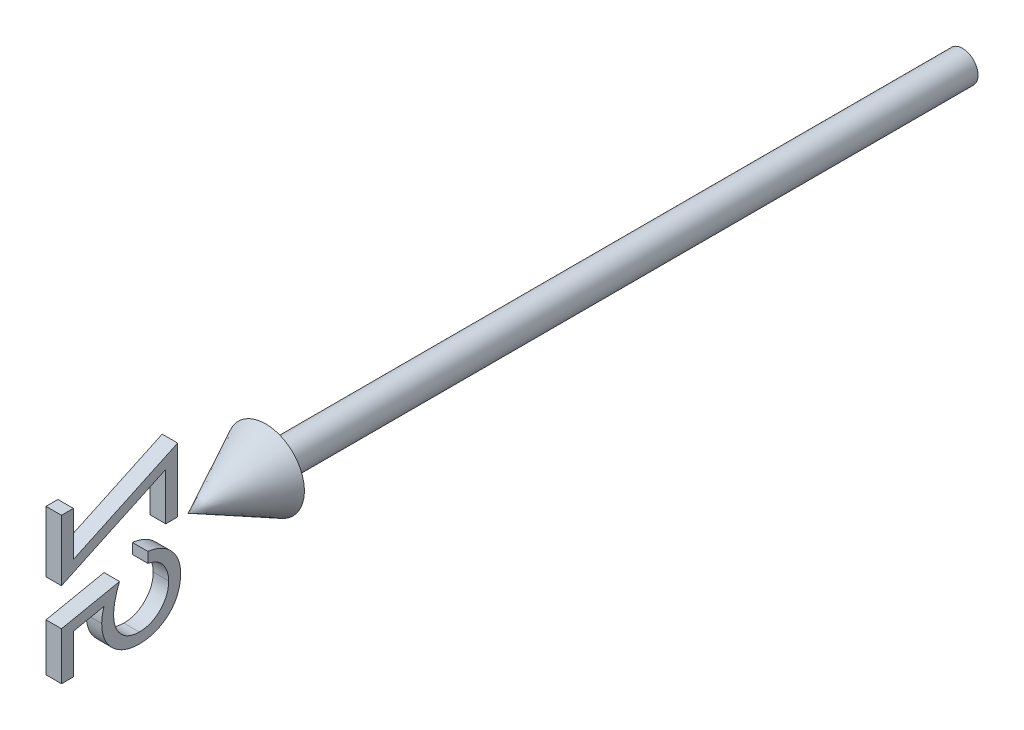
from build123d import *

# Parameters (mm, degrees)
BOSS_EXTRUDE1_DEPTH        = 1
BOSS_EXTRUDE1_DEPTH_BACK   = 1
BOSS_EXTRUDE1_2_DEPTH      = 1
BOSS_EXTRUDE1_2_DEPTH_BACK = 1


with BuildPart() as part:
    # Sketch2 → Revolve1 (revolve)
    with BuildSketch(Plane(origin=(0, 0, 0), x_dir=(1, 0, 0), z_dir=(0, 1, 0))):
        Polygon((0, -100), (5, -90), (2, -90), (2, 0), (0, 0), align=None)
    revolve(axis=Axis((0, 0, -41.949952025), (0, 0, 1)))


with BuildPart() as body_2:
    # Sketch3 → Boss-Extrude1 (new, two sides: drawn at the far end of the back side and taken through both)
    with BuildSketch(Plane(origin=(0, 0, 0), x_dir=(0, -1, 0), z_dir=(1, 0, 0)).offset(-BOSS_EXTRUDE1_DEPTH_BACK)):
        Polygon((-8.958586521, -115.829050545), (-8.958586521, -117.367512083), (-1.073971137, -117.367512083), (-7.366038444, -103.905973622), (-1.266278829, -103.905973622), (-1.266278829, -102.367512083), (-9.535509598, -102.367512083), (-3.243442291, -115.829050545), align=None)
    extrude(amount=BOSS_EXTRUDE1_DEPTH + BOSS_EXTRUDE1_DEPTH_BACK)


with BuildPart() as body_3:
    # Sketch3 → Boss-Extrude1 2 (new, two sides: drawn at the far end of the back side and taken through both)
    with BuildSketch(Plane(origin=(0, 0, 0), x_dir=(0, -1, 0), z_dir=(1, 0, 0)).offset(-BOSS_EXTRUDE1_2_DEPTH_BACK)):
        with BuildLine():
            Line((9.887567325, -117.367512083), (9.887567325, -115.829050545))
            Line((9.887567325, -115.829050545), (4.785403863, -115.829050545))
            Line((4.785403863, -115.829050545), (3.977110594, -111.883738045))
            add(Edge.make_bspline(
                [(3.977110594, -111.883738045), (4.135921484, -111.927582067), (4.443592466, -112.012522925), (4.897706156, -112.10683337), (5.3288156, -112.163685273), (5.608567187, -112.171448032), (5.743937517, -112.175204391)],
                knots=[0, 0, 0, 0, 1.100273476, 2.13160584, 3.095893838, 4, 4, 4, 4], degree=3))
            add(Edge.make_bspline(
                [(5.743937517, -112.175204391), (5.911469427, -112.171697732), (6.24087902, -112.164802764), (6.722105689, -112.094696993), (7.183764435, -111.99308592), (7.619214914, -111.836788699), (8.035477483, -111.644691804), (8.426908648, -111.405881899), (8.795347102, -111.123761902), (9.139987498, -110.804119156), (9.450692918, -110.448231973), (9.721766713, -110.065265577), (9.953469806, -109.659493302), (10.13830025, -109.227182734), (10.288157328, -108.772407934), (10.387242998, -108.291352851), (10.453352538, -107.788019887), (10.460728922, -107.443855203), (10.464490402, -107.268353429)],
                knots=[0, 0, 0, 0, 1.052656913, 2.069786496, 3.052102726, 4.020122636, 4.972424848, 5.930457368, 6.896570172, 7.885826804, 8.881139003, 9.861434336, 10.831623367, 11.813212553, 12.812997731, 13.836986694, 14.897002833, 16, 16, 16, 16], degree=3))
            add(Edge.make_bspline(
                [(10.464490402, -107.268353429), (10.461637896, -107.146115945), (10.455971432, -106.903292912), (10.4272095, -106.542666063), (10.371651619, -106.1897154), (10.297859754, -105.845140035), (10.199737382, -105.508425741), (10.083702808, -105.178778067), (9.94481725, -104.856742379), (9.78632982, -104.543921093), (9.606012689, -104.24647133), (9.41357379, -103.960927161), (9.203882177, -103.695572515), (8.980608649, -103.445971941), (8.739466144, -103.219304391), (8.486372312, -103.006114333), (8.215667474, -102.81544457), (7.932123942, -102.640083101), (7.635940617, -102.483068167), (7.324108821, -102.352090458), (7.003475543, -102.237287143), (6.671182611, -102.143928535), (6.327873889, -102.071495734), (5.972367137, -102.022169983), (5.606446231, -101.986281206), (5.358410975, -101.984032562), (5.233120209, -101.982896699)],
                knots=[0, 0, 0, 0, 1.056281413, 2.098288097, 3.122646807, 4.141030392, 5.140675379, 6.150604744, 7.15845591, 8.168533554, 9.177684096, 10.161739049, 11.141561652, 12.097360316, 13.052218386, 13.998410789, 14.954052752, 15.909851415, 16.877523809, 17.846742625, 18.829312613, 19.818263486, 20.826374662, 21.858017533, 22.918014209, 24, 24, 24, 24], degree=3))
            add(Edge.make_bspline(
                [(5.233120209, -101.982896699), (5.083663432, -101.985865656), (4.789624879, -101.99170673), (4.358765469, -102.052525869), (3.944482382, -102.140227886), (3.548493848, -102.270093438), (3.17266208, -102.440391196), (2.811535272, -102.641429112), (2.471723833, -102.884073914), (2.150816973, -103.159626891), (1.856439093, -103.465249691), (1.585431088, -103.79017271), (1.350772111, -104.141602631), (1.146876605, -104.513676484), (0.973427436, -104.907364263), (0.837046103, -105.323579747), (0.72700461, -105.76030116), (0.680445908, -106.060958082), (0.656798094, -106.213665929)],
                knots=[0, 0, 0, 0, 1.04695683, 2.059763882, 3.044413726, 4.012427942, 4.974081556, 5.932886124, 6.904940154, 7.895678616, 8.893654631, 9.876199664, 10.857615262, 11.850515636, 12.847107701, 13.868396357, 14.917328757, 16, 16, 16, 16], degree=3))
            Line((0.656798094, -106.213665929), (2.00295194, -106.213665929))
            add(Edge.make_bspline(
                [(2.00295194, -106.213665929), (2.036032743, -106.070595283), (2.099615882, -105.795605556), (2.23990822, -105.409710409), (2.408726247, -105.064401109), (2.618776332, -104.761849213), (2.857370729, -104.49187079), (3.132747288, -104.251786261), (3.442565873, -104.03780022), (3.786895688, -103.857974855), (4.151090117, -103.706719992), (4.530034101, -103.598725653), (4.918346783, -103.53336705), (5.179786156, -103.52537624), (5.311245209, -103.521358237)],
                knots=[0, 0, 0, 0, 1.136370375, 2.184166959, 3.172867797, 4.104539607, 5.027679118, 5.956634301, 6.927059835, 7.936867459, 8.959641981, 9.976160943, 10.98235693, 12, 12, 12, 12], degree=3))
            add(Edge.make_bspline(
                [(5.311245209, -103.521358237), (5.439627651, -103.524905289), (5.692413729, -103.531889463), (6.064618753, -103.584777356), (6.422918413, -103.668370335), (6.767948739, -103.78547931), (7.098014319, -103.940407618), (7.412648474, -104.130728115), (7.716333445, -104.351692477), (8.0010767, -104.604246677), (8.26180345, -104.882719623), (8.49219042, -105.180471674), (8.684090536, -105.498117452), (8.845808395, -105.83014468), (8.96860818, -106.180195793), (9.056212403, -106.546629359), (9.107654079, -106.930350714), (9.114730565, -107.192076326), (9.118336556, -107.325444775)],
                knots=[0, 0, 0, 0, 1.027268864, 2.022700798, 3.002744649, 3.968653148, 4.933396556, 5.915045722, 6.907600446, 7.935526002, 8.956456544, 9.95700807, 10.942805781, 11.92166854, 12.907987664, 13.905483474, 14.932689774, 16, 16, 16, 16], degree=3))
            add(Edge.make_bspline(
                [(9.118336556, -107.325444775), (9.11605731, -107.445856624), (9.111612247, -107.680688009), (9.059043658, -108.023935146), (8.98823791, -108.351583459), (8.876564493, -108.660571604), (8.740921344, -108.954125409), (8.564183938, -109.224991508), (8.36878926, -109.486414162), (8.134790794, -109.721110277), (7.88142437, -109.939534001), (7.600648632, -110.124788034), (7.300487573, -110.282404722), (6.980241671, -110.411524443), (6.639555436, -110.514383418), (6.27823456, -110.585469333), (5.896199729, -110.628006407), (5.634875518, -110.633776748), (5.500548094, -110.636742852)],
                knots=[0, 0, 0, 0, 1.045820996, 2.039596555, 3.013371638, 3.9552447, 4.890047302, 5.817684688, 6.761648481, 7.722253242, 8.692244539, 9.66551337, 10.63924952, 11.635311376, 12.662847378, 13.728455105, 14.832366986, 16, 16, 16, 16], degree=3))
            add(Edge.make_bspline(
                [(5.500548094, -110.636742852), (5.383271567, -110.634339099), (5.14318831, -110.629418243), (4.774060713, -110.590692129), (4.387850998, -110.531115728), (3.983059776, -110.445247123), (3.560797928, -110.337733716), (3.120363225, -110.203462951), (2.661745026, -110.048799963), (2.353062139, -109.92883808), (2.195259633, -109.867512083)],
                knots=[0, 0, 0, 0, 0.824638674, 1.688163388, 2.607705698, 3.571998603, 4.597075385, 5.671199175, 6.809488238, 8, 8, 8, 8], degree=3))
            Line((2.195259633, -109.867512083), (3.733721171, -117.367512083))
            Line((3.733721171, -117.367512083), (9.887567325, -117.367512083))
        make_face()
    extrude(amount=BOSS_EXTRUDE1_2_DEPTH + BOSS_EXTRUDE1_2_DEPTH_BACK)


solid = Compound([part.part, body_2.part, body_3.part])
